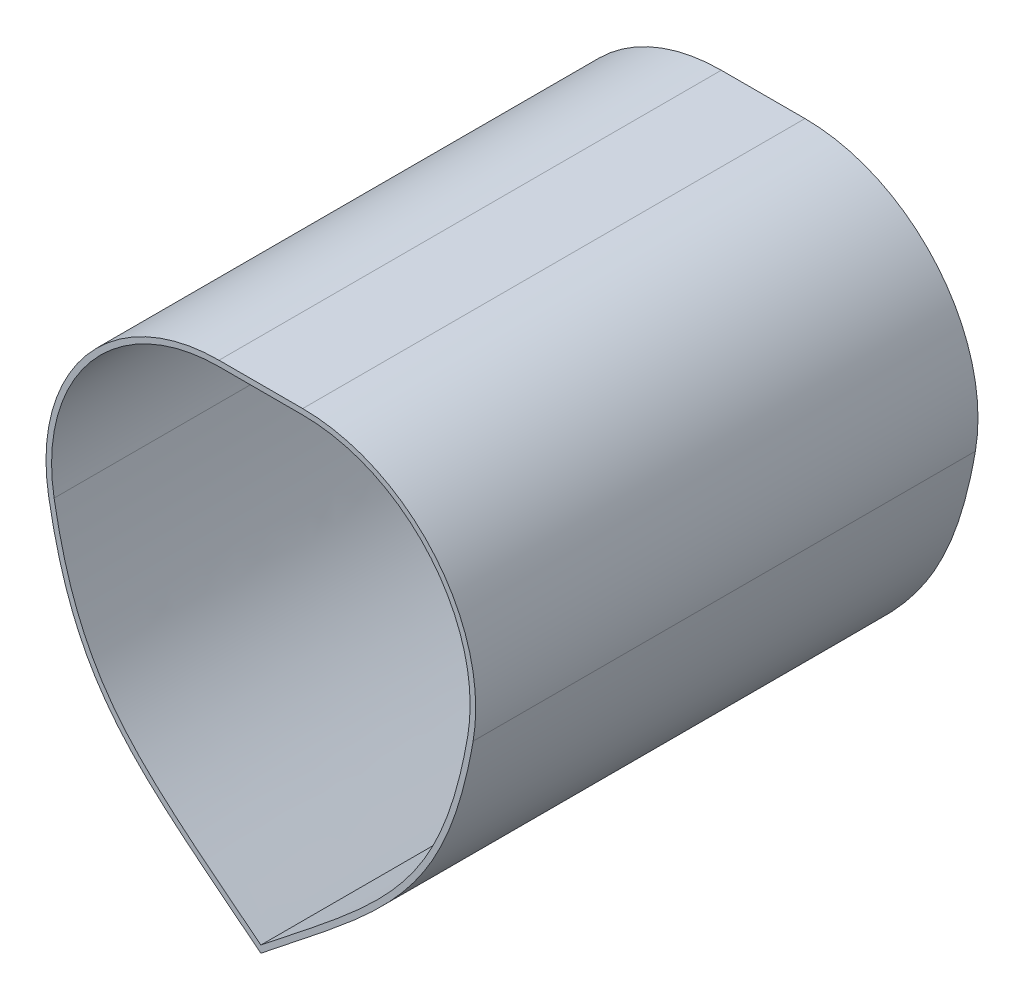
from build123d import *

# Parameters (mm, degrees)
EXTRUDE_THIN1_DEPTH = 90
BOSS_EXTRUDE2_DEPTH = 1


# Read off the part's stored shape, not the designer's step: Extrude-Thin1
with BuildPart() as part:
    # Extrude-Thin1 outline → Extrude-Thin1 (new body)
    with BuildSketch(Plane.XY):
        with BuildLine():
            ThreePointArc((38.035382168, -35.347002514), (31.235596453, -10.059552135), (7.5, 1))
            Line((7.5, 1), (-7.5, 1))
            ThreePointArc((-7.5, 1), (-31.235596453, -10.059552135), (-38.035382168, -35.347002514))
            add(Edge.make_bspline(
                [(-38.035382168, -35.347002514), (-37.554877275, -38.091044712), (-36.982288394, -40.80608362), (-35.565158765, -46.150505954), (-34.720196751, -48.779756695), (-33.161578556, -52.631922641), (-32.593300375, -53.900626917), (-31.656964897, -55.777251982), (-31.330213147, -56.399449481), (-30.654628096, -57.62175288), (-30.305133925, -58.2232973), (-28.499758373, -61.183478516), (-26.866970732, -63.396871822), (-23.293608141, -67.570959051), (-21.3552031, -69.53343451), (-18.308631284, -72.363055335), (-17.269106946, -73.288189322), (-15.166205404, -75.105501428), (-14.102048687, -75.998509971), (-10.886176236, -78.648715419), (-8.712008649, -80.378262626), (-5.44481379, -82.965263978), (-4.354506385, -83.826067669), (-2.175474488, -85.549624425), (-1.08730397, -86.413059715), (0, -87.277562168)],
                knots=[0, 0, 0, 0, 0.125, 0.125, 0.25, 0.25, 0.3125, 0.3125, 0.34375, 0.34375, 0.375, 0.375, 0.5, 0.5, 0.625, 0.625, 0.6875, 0.6875, 0.75, 0.75, 0.875, 0.875, 0.9375, 0.9375, 1, 1, 1, 1], degree=3))
            add(Edge.make_bspline(
                [(0, -87.277562168), (1.08825792, -86.412301242), (2.17738223, -85.548112852), (4.358314452, -83.823058195), (5.449569509, -82.961507531), (8.719600502, -80.37223287), (10.895651555, -78.64113564), (15.18721231, -75.103994895), (17.307070745, -73.293975682), (21.367054903, -69.521739888), (23.306811774, -67.557448149), (26.887981037, -63.370398667), (28.527198921, -61.145739745), (30.341570945, -58.161630502), (30.693803217, -57.553099071), (31.368590392, -56.327520761), (31.691581341, -55.709949334), (32.619510062, -53.843606709), (33.183356969, -52.581191644), (34.731190275, -48.746229651), (35.57222373, -46.126216436), (36.984199031, -40.79650843), (37.555591946, -38.086963412), (38.035382168, -35.347002514)],
                knots=[0, 0, 0, 0, 0.0625, 0.0625, 0.125, 0.125, 0.25, 0.25, 0.375, 0.375, 0.5, 0.5, 0.625, 0.625, 0.65625, 0.65625, 0.6875, 0.6875, 0.75, 0.75, 0.875, 0.875, 1, 1, 1, 1], degree=3))
        make_face()
        with BuildLine():
            Line((-7.5, 0), (7.5, 0))
            ThreePointArc((7.5, 0), (30.469932051, -10.702792389), (37.05036984, -35.174518562))
            add(Edge.make_bspline(
                [(0, -86), (21.809200373, -68.659764212), (32.382238463, -61.833038962), (37.05036984, -35.174518562)],
                knots=[0.066518743, 0.066518743, 0.066518743, 0.066518743, 1, 1, 1, 1], degree=3))
            add(Edge.make_bspline(
                [(-37.05036984, -35.174518562), (-32.382238463, -61.833038961), (-21.809200373, -68.659764214), (0, -86)],
                knots=[0.066518743, 0.066518743, 0.066518743, 0.066518743, 1, 1, 1, 1], degree=3))
            ThreePointArc((-37.05036984, -35.174518562), (-30.469932051, -10.702792389), (-7.5, 0))
        make_face(mode=Mode.SUBTRACT)
    extrude(amount=EXTRUDE_THIN1_DEPTH)

    # Sketch3 → Boss-Extrude2 (add)
    with BuildSketch(Plane(origin=(0, 0, 0), x_dir=(-1, 0, 0), z_dir=(0, 0, -1))):
        with BuildLine():
            Line((-7.5, 0), (7.5, 0))
            ThreePointArc((7.5, 0), (29.490350716, -9.59351879), (37.41637858, -32.238368308))
            add(Edge.make_bspline(
                [(37.41637858, -32.238368308), (35.460561449, -58.378376411), (20.563045318, -69.893350067), (0, -86)],
                knots=[0.066518743, 0.066518743, 0.066518743, 0.066518743, 1, 1, 1, 1], degree=3))
            add(Edge.make_bspline(
                [(-37.41637858, -32.238368308), (-35.460561449, -58.378376411), (-20.563045318, -69.893350067), (0, -86)],
                knots=[0.066518743, 0.066518743, 0.066518743, 0.066518743, 1, 1, 1, 1], degree=3))
            ThreePointArc((-37.41637858, -32.238368308), (-29.490350716, -9.59351879), (-7.5, 0))
        make_face()
    extrude(amount=-BOSS_EXTRUDE2_DEPTH)


solid = part.part
